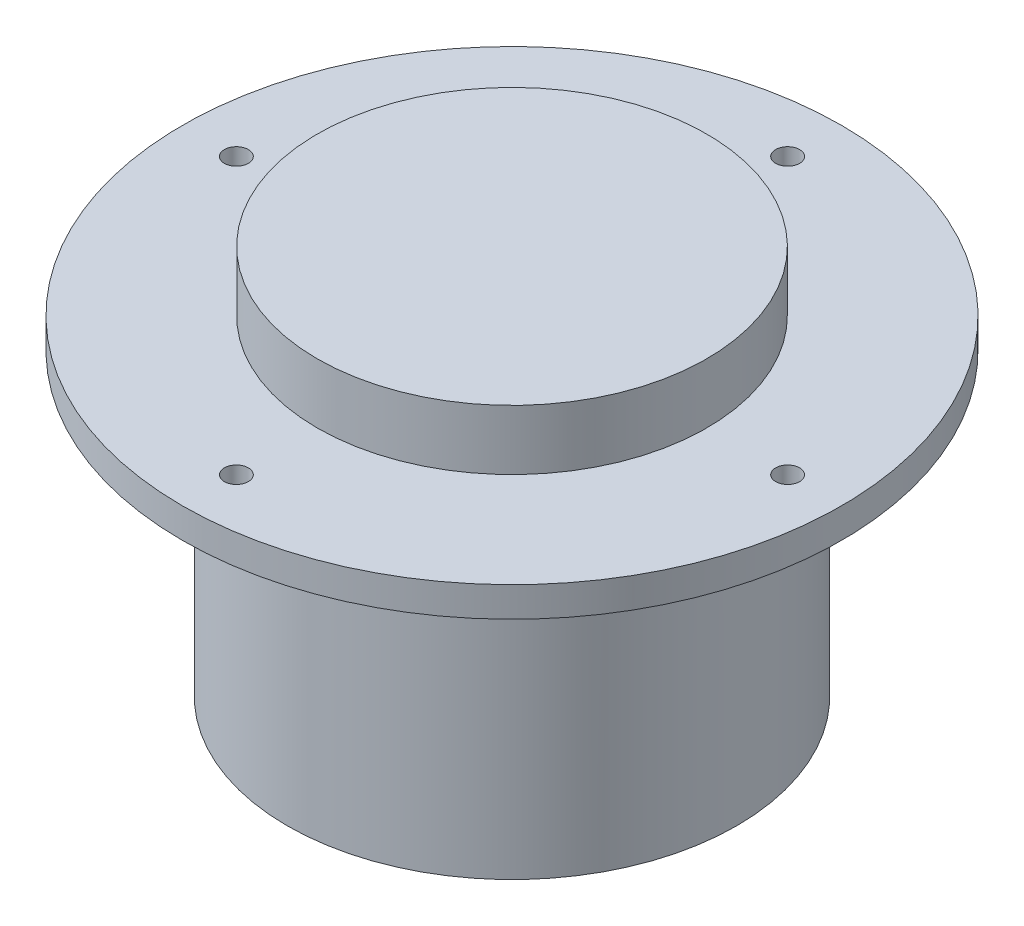
from build123d import *

# Parameters (mm, degrees)
SKETCH1_R             = 55
SKETCH1_R_2           = 2
SKETCH1_R_3           = 32.5
BOSS_EXTRUDE1_DEPTH   = 5
SKETCH3_R             = 37.5
SKETCH3_R_2           = 32.5
BOSS_EXTRUDE3_DEPTH   = 50
BOSS_EXTRUDE4_START   = 15
SKETCH1_4_R           = 32.5
BOSS_EXTRUDE4_DEPTH   = 15
CIRPATTERN1_OUTLINE_R = 2
CIRPATTERN1_DEPTH     = 5


# Read off the part's stored shape, not the designer's step: CirPattern1
with BuildPart() as part:
    # Sketch1 → Boss-Extrude1 (new body)
    # profile 1 of 2: a face of its own
    with BuildSketch(Plane(origin=(0, 0, 0), x_dir=(1, 0, 0), z_dir=(0, 1, 0))):
        with Locations(Location((0, 0, 0), (0, 0, 270))):
            Circle(SKETCH1_R)
        with Locations(Location((0, 46, 0), (0, 0, 270))):
            Circle(SKETCH1_R_2, mode=Mode.SUBTRACT)
        Circle(SKETCH1_R_3, mode=Mode.SUBTRACT)
    # profile 2 of 2: a face of its own
    with BuildSketch(Plane(origin=(0, 0, 0), x_dir=(1, 0, 0), z_dir=(0, 1, 0))):
        Circle(SKETCH1_R_3)
    extrude(amount=BOSS_EXTRUDE1_DEPTH)

    # Sketch3 → Boss-Extrude3 (add)
    with BuildSketch(Plane.XZ):
        with Locations(Location((0, 0, 0), (0, 0, 90))):
            Circle(SKETCH3_R)
        with Locations(Location((0, 0, 0), (0, 0, 270))):
            Circle(SKETCH3_R_2, mode=Mode.SUBTRACT)
    extrude(amount=BOSS_EXTRUDE3_DEPTH)

    # Sketch1<4> → Boss-Extrude4 (add)
    with BuildSketch(Plane(origin=(0, 0, 0), x_dir=(1, 0, 0), z_dir=(0, 1, 0)).offset(BOSS_EXTRUDE4_START)):
        with Locations(Location((0, 0, 0), (0, 0, 90))):
            Circle(SKETCH1_4_R)
    extrude(amount=-BOSS_EXTRUDE4_DEPTH)

    # CirPattern1 outline → CirPattern1 (cut)
    with BuildSketch(Plane(origin=(0, 0, 0), x_dir=(1, 0, 0), z_dir=(0, 1, 0))):
        with Locations((46, 0)):
            Circle(CIRPATTERN1_OUTLINE_R)
        with Locations((0, -46)):
            Circle(CIRPATTERN1_OUTLINE_R)
        with Locations((-46, 0)):
            Circle(CIRPATTERN1_OUTLINE_R)
    extrude(amount=CIRPATTERN1_DEPTH, mode=Mode.SUBTRACT)


solid = part.part
